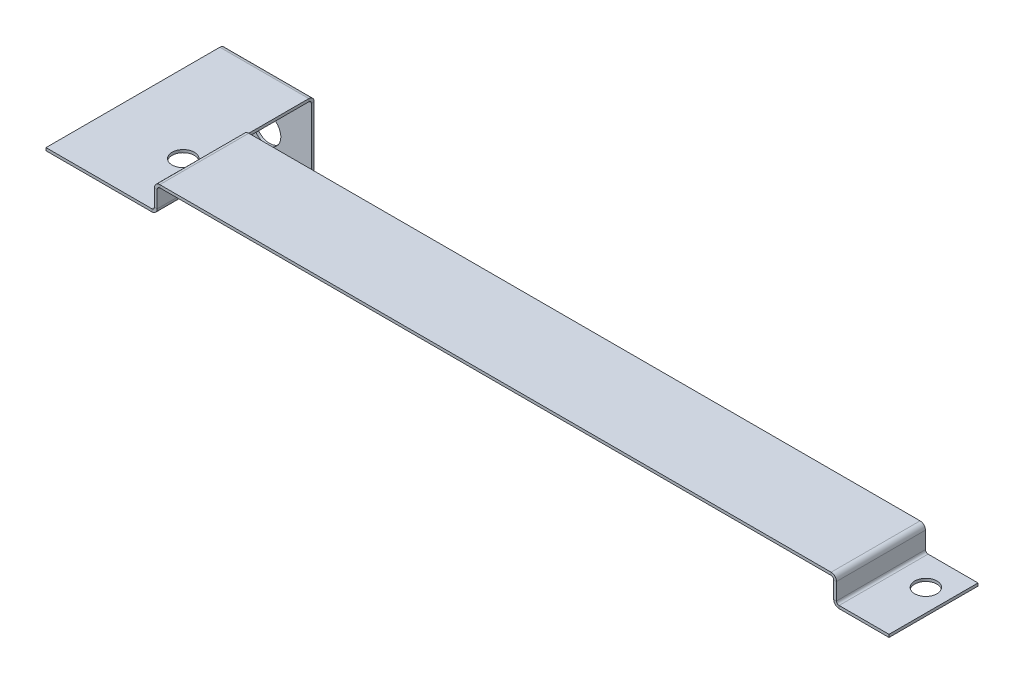
from build123d import *

# Parameters (mm, degrees)
SKETCH1_W                    = 14.25702
SKETCH1_H                    = 25.4
SKETCH1_R                    = 3.175
BASE_FLANGE1_DEPTH           = 0.79375
EDGE_FLANGE1_DEPTH           = 25.4
EDGE_FLANGE2_DEPTH           = 25.4
EDGE_FLANGE3_DEPTH           = 25.4
EDGE_FLANGE4_STRIP_W         = 4.6482
EDGE_FLANGE4_STRIP_H         = 0.79375
EDGE_FLANGE4_STRIP_CUT_DEPTH = 25.4
EDGE_FLANGE4_DEPTH           = 25.4
SKETCH16_R                   = 3.175
CUT_EXTRUDE1_DEPTH           = 236.022644323
SKETCH17_W                   = 25.4
SKETCH17_H                   = 25.7556
TAB1_DEPTH                   = 0.79375
EDGE_FLANGE5_STRIP_W         = 4.6482
EDGE_FLANGE5_STRIP_H         = 0.79375
EDGE_FLANGE5_STRIP_CUT_DEPTH = 25.4
EDGE_FLANGE5_DEPTH           = 25.4
SKETCH25_R                   = 3.96875
CUT_EXTRUDE2_DEPTH           = 242.170466728


# Sheet-metal steps are written as plain solids
with BuildPart() as part:
    # Sketch1 → Base-Flange1 (new body)
    with BuildSketch(Plane(origin=(0, 0, 0), x_dir=(1, 0, 0), z_dir=(0, 1, 0))):
        with Locations((-0.77851, -4.160748346)):
            Rectangle(SKETCH1_W, SKETCH1_H)
        with Locations(Location((0, 0, 0), (0, 0, 270))):
            Circle(SKETCH1_R, mode=Mode.SUBTRACT)
    extrude(amount=-BASE_FLANGE1_DEPTH)

    # Edge-Flange1 section (across the edge) → Edge-Flange1 (add)
    with BuildSketch(Plane(origin=(-8.64362, 0, -8.539251654), x_dir=(1, 0, 0), z_dir=(0, 0, 1))):
        with BuildLine():
            Line((-0.79375, 0.7366), (-0.79375, 5.55625))
            Line((-0.79375, 5.55625), (0, 5.55625))
            Line((0, 5.55625), (0, 0.7366))
            ThreePointArc((0, 0.7366), (0.215745145, 0.215745145), (0.7366, 0))
            Line((0.7366, 0), (0.7366, -0.79375))
            ThreePointArc((0.7366, -0.79375), (-0.345520863, -0.345520863), (-0.79375, 0.7366))
        make_face()
    extrude(amount=EDGE_FLANGE1_DEPTH)

    # Edge-Flange2 section (across the edge) → Edge-Flange2 (add)
    with BuildSketch(Plane(origin=(-9.43737, 6.29285, 16.860748346), x_dir=(0, -1, 0), z_dir=(0, 0, -1))):
        with BuildLine():
            Line((-0.79375, 0.7366), (-0.79375, 192.38595))
            Line((-0.79375, 192.38595), (0, 192.38595))
            Line((0, 192.38595), (0, 0.7366))
            ThreePointArc((0, 0.7366), (0.215745145, 0.215745145), (0.7366, 0))
            Line((0.7366, 0), (0.7366, -0.79375))
            ThreePointArc((0.7366, -0.79375), (-0.345520863, -0.345520863), (-0.79375, 0.7366))
        make_face()
    extrude(amount=EDGE_FLANGE2_DEPTH)

    # Edge-Flange3 section (across the edge) → Edge-Flange3 (add)
    with BuildSketch(Plane(origin=(-202.55992, 6.29285, 16.860748346), x_dir=(1, 0, 0), z_dir=(0, 0, -1))):
        with BuildLine():
            Line((-0.79375, 0.7366), (-0.79375, 7.0866))
            Line((-0.79375, 7.0866), (0, 7.0866))
            Line((0, 7.0866), (0, 0.7366))
            ThreePointArc((0, 0.7366), (0.215745145, 0.215745145), (0.7366, 0))
            Line((0.7366, 0), (0.7366, -0.79375))
            ThreePointArc((0.7366, -0.79375), (-0.345520863, -0.345520863), (-0.79375, 0.7366))
        make_face()
    extrude(amount=EDGE_FLANGE3_DEPTH)

    # Edge-Flange4 strip (across the edge) → Edge-Flange4 strip cut (cut)
    with BuildSketch(Plane(origin=(-203.35367, -0.79375, -8.539251654), x_dir=(0, 1, 0), z_dir=(0, 0, 1))):
        with Locations((-0.79375, -0.396875)):
            Rectangle(EDGE_FLANGE4_STRIP_W, EDGE_FLANGE4_STRIP_H)
    extrude(amount=EDGE_FLANGE4_STRIP_CUT_DEPTH, mode=Mode.SUBTRACT)

    # Edge-Flange4 section (across the edge) → Edge-Flange4 (add)
    with BuildSketch(Plane(origin=(-203.35367, -0.79375, -8.539251654), x_dir=(0, 1, 0), z_dir=(0, 0, 1))):
        with BuildLine():
            Line((0, 0.7366), (0, 30.95625))
            Line((0, 30.95625), (0.79375, 30.95625))
            Line((0.79375, 30.95625), (0.79375, 0.7366))
            ThreePointArc((0.79375, 0.7366), (1.009495145, 0.215745145), (1.53035, 0))
            Line((1.53035, 0), (1.53035, -0.79375))
            ThreePointArc((1.53035, -0.79375), (0.448229137, -0.345520863), (0, 0.7366))
        make_face()
    extrude(amount=EDGE_FLANGE4_DEPTH)

    # Sketch16 → Cut-Extrude1 (cut, through all)
    with BuildSketch(Plane(origin=(0, 0, 0), x_dir=(1, 0, 0), z_dir=(0, 1, 0))):
        with Locations(Location((-211.998031426, 0, 0), (0, 0, 180))):
            Circle(SKETCH16_R)
    extrude(amount=-CUT_EXTRUDE1_DEPTH, mode=Mode.SUBTRACT)

    # Sketch17 → Tab1 (add)
    with BuildSketch(Plane(origin=(0, 0, 0), x_dir=(1, 0, 0), z_dir=(0, 1, 0))):
        with Locations((-221.60992, 21.417051654)):
            Rectangle(SKETCH17_W, SKETCH17_H)
    extrude(amount=-TAB1_DEPTH)

    # Edge-Flange5 strip (across the edge) → Edge-Flange5 strip cut (cut)
    with BuildSketch(Plane(origin=(-234.30992, -0.79375, -34.294851654), x_dir=(0, 0, 1), z_dir=(1, 0, 0))):
        with Locations((-0.79375, -0.396875)):
            Rectangle(EDGE_FLANGE5_STRIP_W, EDGE_FLANGE5_STRIP_H)
    extrude(amount=EDGE_FLANGE5_STRIP_CUT_DEPTH, mode=Mode.SUBTRACT)

    # Edge-Flange5 section (across the edge) → Edge-Flange5 (add)
    with BuildSketch(Plane(origin=(-234.30992, -0.79375, -34.294851654), x_dir=(0, 0, 1), z_dir=(1, 0, 0))):
        with BuildLine():
            Line((0, 0.7366), (0, 24.60625))
            Line((0, 24.60625), (0.79375, 24.60625))
            Line((0.79375, 24.60625), (0.79375, 0.7366))
            ThreePointArc((0.79375, 0.7366), (1.009495145, 0.215745145), (1.53035, 0))
            Line((1.53035, 0), (1.53035, -0.79375))
            ThreePointArc((1.53035, -0.79375), (0.448229137, -0.345520863), (0, 0.7366))
        make_face()
    extrude(amount=EDGE_FLANGE5_DEPTH)

    # Sketch25 → Cut-Extrude2 (cut, through all)
    with BuildSketch(Plane(origin=(0, 0, -34.294851654), x_dir=(-1, 0, 0), z_dir=(0, 0, -1))):
        with Locations(Location((221.60992, -14.23035, 0), (0, 0, 90))):
            Circle(SKETCH25_R)
    extrude(amount=-CUT_EXTRUDE2_DEPTH, mode=Mode.SUBTRACT)


solid = part.part
